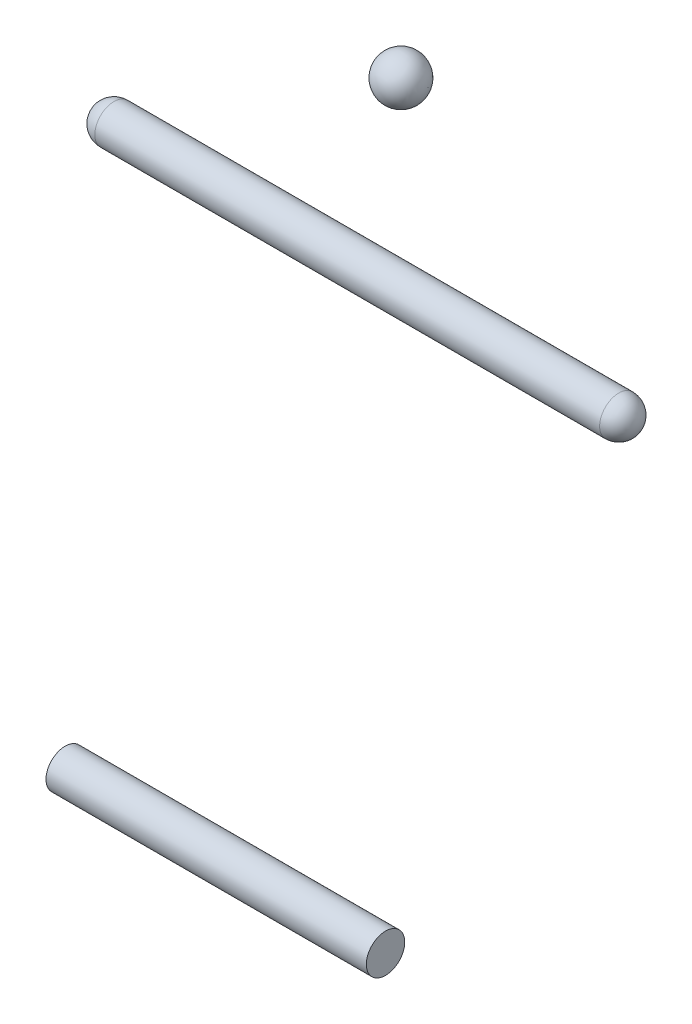
from build123d import *

# Parameters (mm, degrees)
BOSS_EXTRUDE1_DEPTH      = 120
BOSS_EXTRUDE1_DEPTH_BACK = 130
SKETCH2_R                = 15
BOSS_EXTRUDE2_DEPTH      = 212
BOSS_EXTRUDE2_DEPTH_BACK = 212
SKETCH3_R                = 15
FILLET1_R                = 15


# Read off the part's stored shape, not the designer's step: Bill Native-18-surface1
with BuildPart() as part:
    # Sketch1 → Revolve3 (revolve)
    with BuildSketch(Plane(origin=(0, 328.891648569, 0), x_dir=(1, 0, 0), z_dir=(0, 1, 0))):
        with BuildLine():
            Line((0, 135.727059293), (0, 100.447590597))
            ThreePointArc((0, 100.447590597), (-17.639734348, 118.087324945), (0, 135.727059293))
        make_face()
    revolve(axis=Axis((0, 328.891648569, -135.727059293), (0, 0, 1)))


with BuildPart() as body_2:
    # Sketch2 → Boss-Extrude1 (new, two sides: drawn at the far end of the back side and taken through both)
    with BuildSketch(Plane(origin=(0, 0, 0), x_dir=(0, 0, -1), z_dir=(1, 0, 0)).offset(-BOSS_EXTRUDE1_DEPTH_BACK)):
        with Locations((-13.924559583, -136.745277475)):
            Circle(SKETCH2_R)
    extrude(amount=BOSS_EXTRUDE1_DEPTH + BOSS_EXTRUDE1_DEPTH_BACK)


with BuildPart() as body_3:
    # Sketch3 → Boss-Extrude2 (new, two sides: drawn at the far end of the back side and taken through both)
    with BuildSketch(Plane(origin=(0, 0, 0), x_dir=(0, 0, -1), z_dir=(1, 0, 0)).offset(-BOSS_EXTRUDE2_DEPTH_BACK)):
        with Locations((91.161648646, 212.883528246)):
            Circle(SKETCH3_R)
    extrude(amount=BOSS_EXTRUDE2_DEPTH + BOSS_EXTRUDE2_DEPTH_BACK)

    # Fillet1
    fillet1_edges = [body_3.edges().sort_by_distance(p)[0] for p in [
        (-212, 212.883528246, -76.161648646),
        (212, 212.883528246, -76.161648646),
    ]]
    fillet(fillet1_edges, radius=FILLET1_R)


solid = Compound([part.part, body_2.part, body_3.part])
